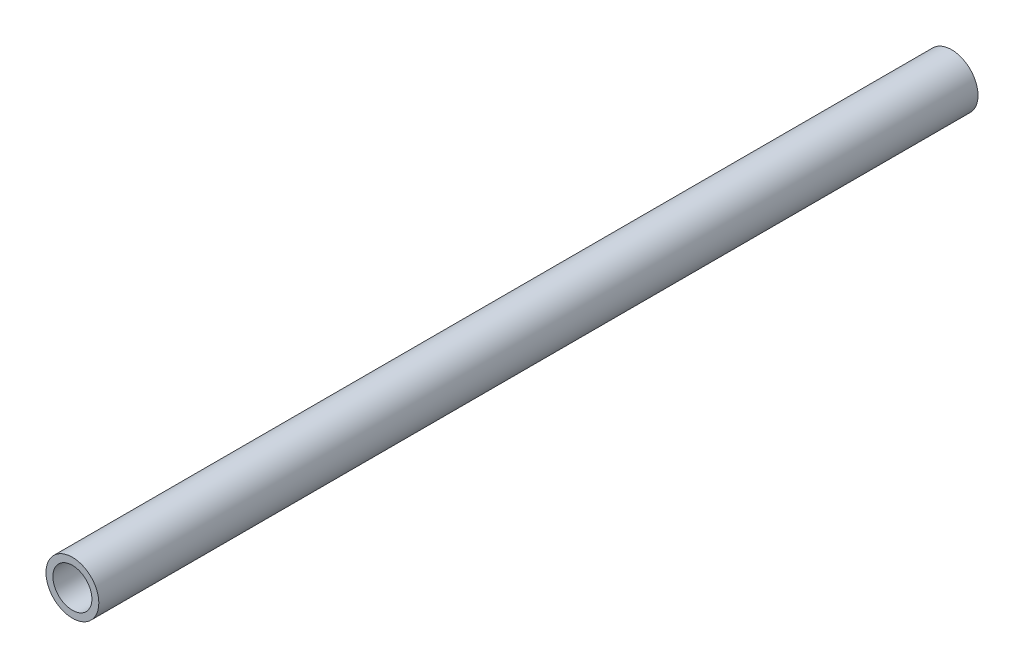
from build123d import *

# Parameters (mm, degrees)
ESQUISSE1_R        = 4.57
ESQUISSE1_R_2      = 3.37
BOSS_EXTRU_1_DEPTH = 152


with BuildPart() as part:
    # Esquisse1 → Boss.-Extru.1 (new body)
    with BuildSketch(Plane.XY):
        Circle(ESQUISSE1_R)
        Circle(ESQUISSE1_R_2, mode=Mode.SUBTRACT)
    extrude(amount=BOSS_EXTRU_1_DEPTH)


solid = part.part
